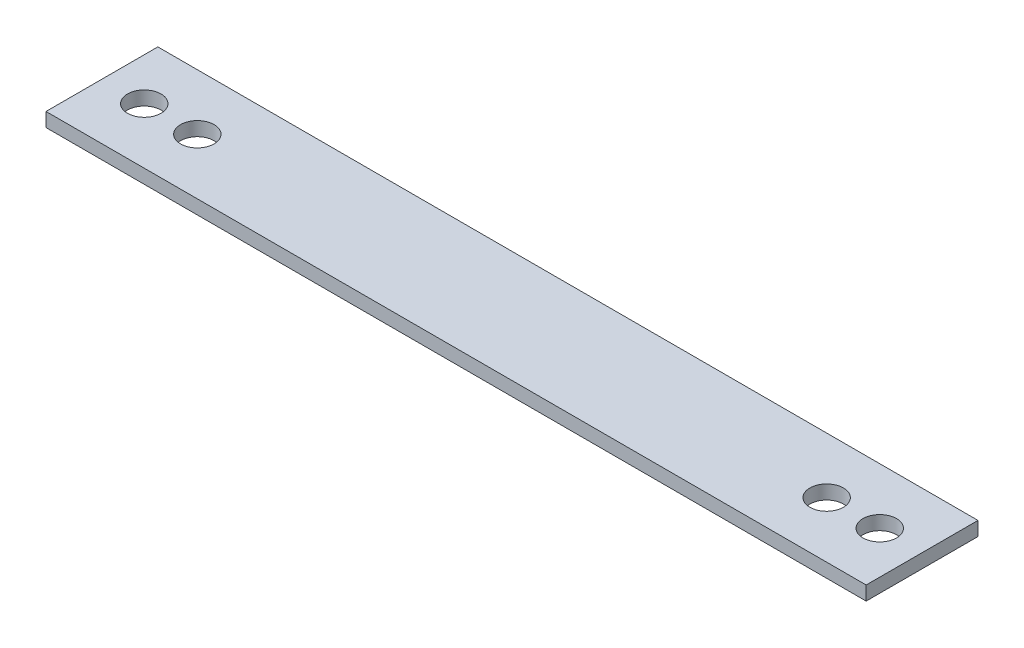
from build123d import *

# Parameters (mm, degrees)
SKETCH2_W           = 279.4
SKETCH2_H           = 38.1
SKETCH2_R           = 5.712354314
BOSS_EXTRUDE1_DEPTH = 4.7625


with BuildPart() as part:
    # Sketch2 → Boss-Extrude1 (new body)
    with BuildSketch(Plane(origin=(0, 0, 0), x_dir=(1, 0, 0), z_dir=(0, 1, 0))):
        Rectangle(SKETCH2_W, SKETCH2_H)
        with Locations((-125.277966102, 0)):
            Circle(SKETCH2_R, mode=Mode.SUBTRACT)
        with Locations((-107.196610169, 0)):
            Circle(SKETCH2_R, mode=Mode.SUBTRACT)
        with Locations((125.277966102, 0)):
            Circle(SKETCH2_R, mode=Mode.SUBTRACT)
        with Locations((107.196610169, 0)):
            Circle(SKETCH2_R, mode=Mode.SUBTRACT)
    extrude(amount=BOSS_EXTRUDE1_DEPTH)


solid = part.part
